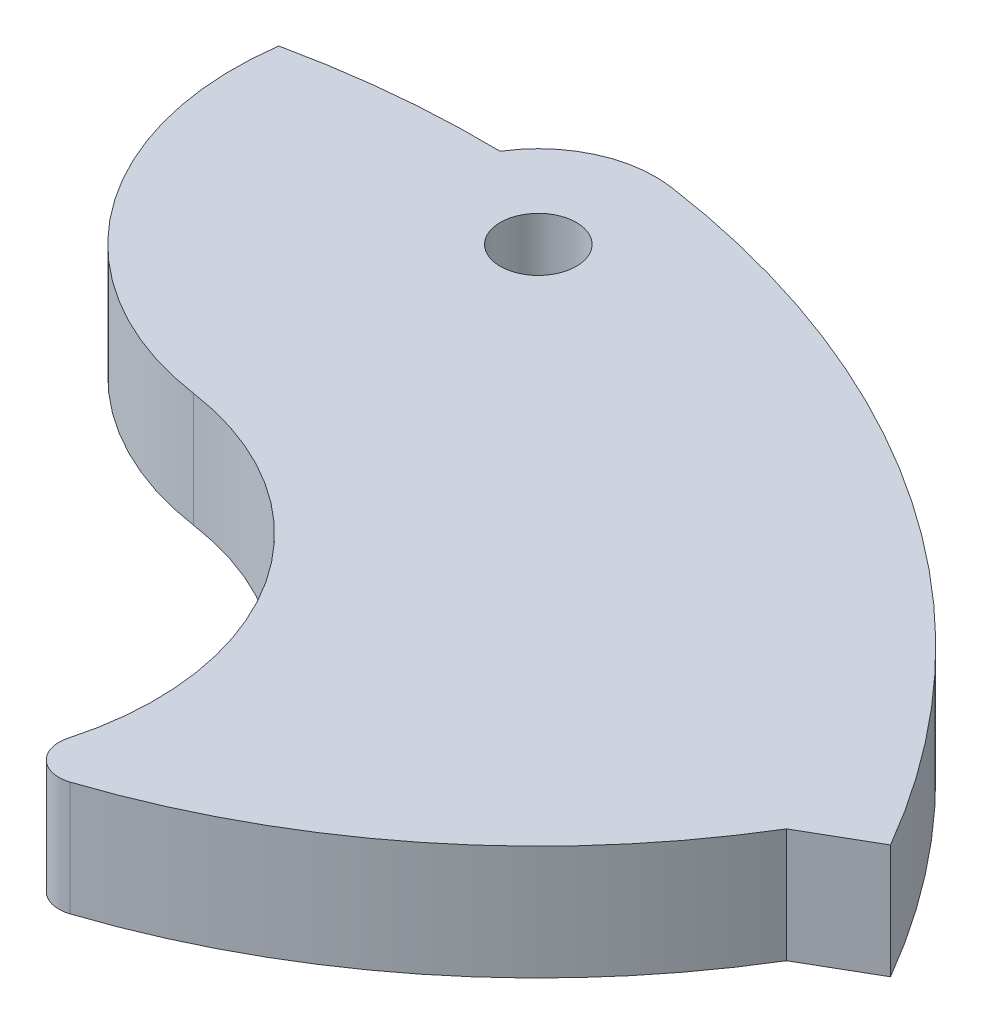
from build123d import *

# Parameters (mm, degrees)
SKETCH1_R           = 3.175
BOSS_EXTRUDE1_DEPTH = 9.525


with BuildPart() as part:
    # Sketch1 → Boss-Extrude1 (new body)
    with BuildSketch(Plane(origin=(0, 0, 0), x_dir=(1, 0, 0), z_dir=(0, 1, 0))):
        with BuildLine():
            Line((67.860884615, 39.1795), (62.361623301, 36.0045))
            ThreePointArc((62.361623301, 36.0045), (48.089936345, 19.783456866), (29.088282696, 9.500439433))
            ThreePointArc((29.088282696, 9.500439433), (26.538834938, 10.072731642), (25.843194862, 12.591319963))
            ThreePointArc((25.843194862, 12.591319963), (22.815385737, 32.115323832), (6.157148148, 42.738763748))
            ThreePointArc((6.157148148, 42.738763748), (-10.524624729, 52.617403719), (-15.377541778, 71.38754677))
            ThreePointArc((-15.377541778, 71.38754677), (-7.00869571, 72.687886263), (1.454422988, 73.010514851))
            ThreePointArc((1.454422988, 73.010514851), (5.63444345, 76.736497697), (11.173412963, 77.558285977))
            ThreePointArc((11.173412963, 77.558285977), (43.929919778, 64.886786246), (67.860884615, 39.1795))
        make_face()
        with Locations((9.779, 67.879213011)):
            Circle(SKETCH1_R, mode=Mode.SUBTRACT)
    extrude(amount=BOSS_EXTRUDE1_DEPTH)


solid = part.part
